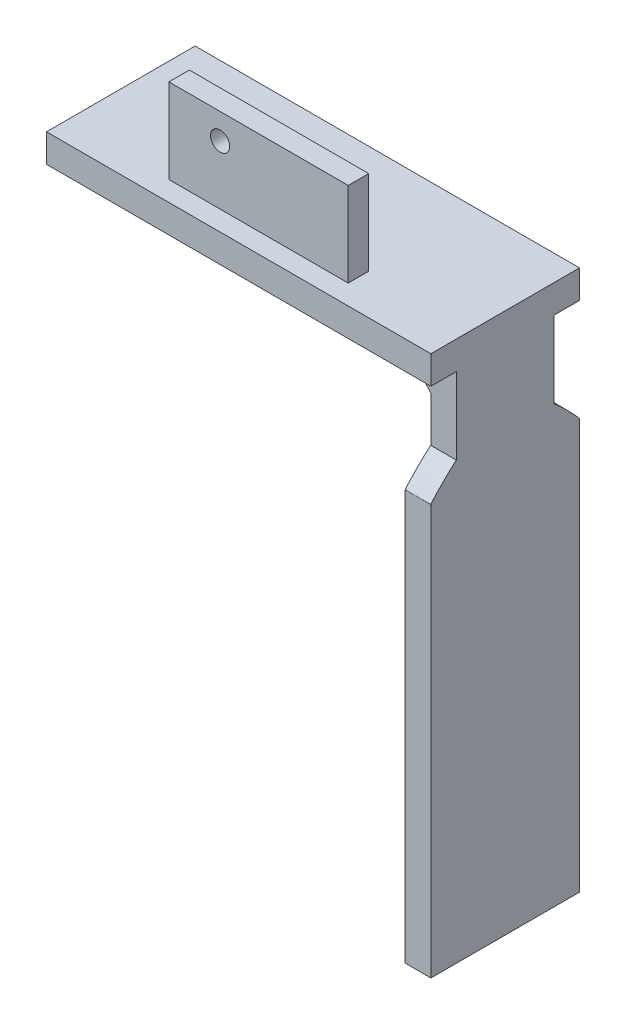
from build123d import *

# Parameters (mm, degrees)
SKETCH1_W           = 60
SKETCH1_H           = 23.2
BOSS_EXTRUDE1_DEPTH = 4.4
SKETCH2_W           = 28
SKETCH2_H           = 3.2
BOSS_EXTRUDE2_DEPTH = 13.2
SKETCH3_W           = 4
SKETCH3_H           = 15.2
BOSS_EXTRUDE3_DEPTH = 80
SKETCH4_W           = 4
SKETCH4_H           = 68
BOSS_EXTRUDE4_DEPTH = 4
FILLET1_SIZE        = 5
FILLET2_SIZE        = 4
SKETCH5_R           = 1.5
CUT_EXTRUDE1_DEPTH  = 10


with BuildPart() as part:
    # Sketch1 → Boss-Extrude1 (new body)
    with BuildSketch(Plane(origin=(0, 0, 0), x_dir=(1, 0, 0), z_dir=(0, 1, 0))):
        with Locations((30, -11.6)):
            Rectangle(SKETCH1_W, SKETCH1_H)
    extrude(amount=BOSS_EXTRUDE1_DEPTH)

    # Sketch2 → Boss-Extrude2 (add)
    with BuildSketch(Plane(origin=(0, 4.4, 0), x_dir=(1, 0, 0), z_dir=(0, 1, 0))):
        with Locations((30, -18.5)):
            Rectangle(SKETCH2_W, SKETCH2_H)
    extrude(amount=BOSS_EXTRUDE2_DEPTH)

    # Sketch3 → Boss-Extrude3 (add)
    with BuildSketch(Plane(origin=(0, 0, 0), x_dir=(-1, 0, 0), z_dir=(0, -1, 0))):
        with Locations((-58, -11.6)):
            Rectangle(SKETCH3_W, SKETCH3_H)
    extrude(amount=BOSS_EXTRUDE3_DEPTH)

    # Sketch4 → Boss-Extrude4 (add)
    with BuildSketch(Plane.ZY.offset(-56)):
        with Locations((21.2, -46)):
            Rectangle(SKETCH4_W, SKETCH4_H)
        with Locations((2, -46)):
            Rectangle(SKETCH4_W, SKETCH4_H)
    extrude(amount=-BOSS_EXTRUDE4_DEPTH)

    # Fillet1
    # a fillet whose section is not a circle: 5 mm, written as the material it adds along each edge
    with BuildSketch(Plane(origin=(56, 0, 4), x_dir=(-1, 0, 0), z_dir=(0, 0, 1))) as fillet1_piece_1:
        with BuildLine():
            Bezier((FILLET1_SIZE, 0), (0, 0), (0, FILLET1_SIZE), weights=[1, 0.052631579, 1])
            Line((0, FILLET1_SIZE), (0, 0))
            Line((0, 0), (FILLET1_SIZE, 0))
        make_face()
    extrude(amount=15.2)

    # Fillet2
    # a fillet whose section is not a circle: 4 mm, written as the material it takes off along each edge
    with BuildSketch(Plane(origin=(46, -12, 0), x_dir=(0, 0, 1), z_dir=(1, 0, 0)), Plane(origin=(46, -12, 23.2), x_dir=(0, -1, 0), z_dir=(1, 0, 0))) as fillet2_piece_1:
        with BuildLine():
            Bezier((FILLET2_SIZE, 0), (0, 0), (0, FILLET2_SIZE), weights=[1, 0.052631579, 1])
            Line((0, FILLET2_SIZE), (0, 0))
            Line((0, 0), (FILLET2_SIZE, 0))
        make_face()
    extrude(amount=24, mode=Mode.SUBTRACT)

    # Sketch5 → Cut-Extrude1 (cut)
    with BuildSketch(Plane.XY.offset(20.1)):
        with Locations((24, 13.6)):
            Circle(SKETCH5_R)
    extrude(amount=-CUT_EXTRUDE1_DEPTH, mode=Mode.SUBTRACT)


solid = part.part
